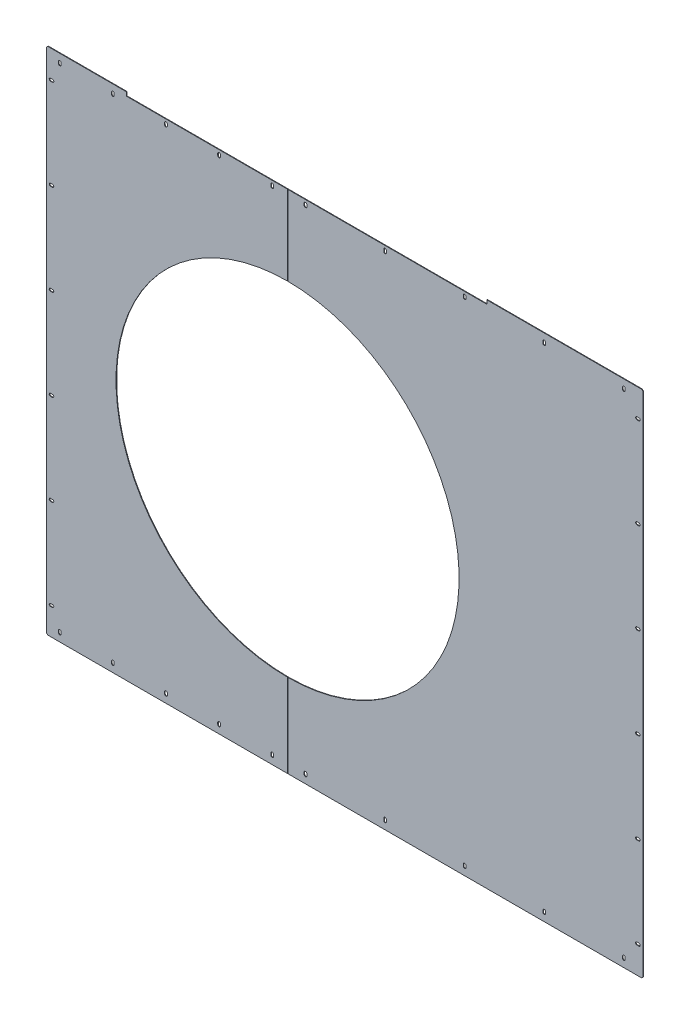
from build123d import *

# Parameters (mm, degrees)
SKETCH_1_W             = 1573
SKETCH_1_H             = 1345
SM_BASE_FLANGE_1_DEPTH = 1.5
SKETCH_4_R             = 452.5
CUT_EXTRUDE_1_DEPTH    = 10
SKETCH_5_W             = 1
SKETCH_5_H             = 1547.457087186
CUT_EXTRUDE_2_DEPTH    = 10
CHAMFER_1_SIZE         = 3
CHAMFER_2_SIZE         = 3
CUT_EXTRUDE_3_DEPTH    = 10
PATTERN_LINEAR_1_COUNT = 5
PATTERN_LINEAR_1_PITCH = 140
CUT_EXTRUDE_4_DEPTH    = 10
PATTERN_LINEAR_2_COUNT = 6
PATTERN_LINEAR_2_PITCH = 240
CUT_EXTRUDE_5_DEPTH    = 10
PATTERN_LINEAR_3_COUNT = 6
PATTERN_LINEAR_3_PITCH = 240
CUT_EXTRUDE_6_DEPTH    = 10
PATTERN_LINEAR_4_COUNT = 5
PATTERN_LINEAR_4_PITCH = 210
SKETCH_15_W            = 425
SKETCH_15_H            = 10
CUT_EXTRUDE_7_DEPTH    = 10
SKETCH_16_W            = 525
SKETCH_16_H            = 10
CUT_EXTRUDE_8_DEPTH    = 10


# Sheet-metal steps are written as plain solids
with BuildPart() as part:
    # Sketch 1 → 基体-法兰1 (new body)
    with BuildSketch(Plane.XY):
        Rectangle(SKETCH_1_W, SKETCH_1_H)
    extrude(amount=-SM_BASE_FLANGE_1_DEPTH)

    # Sketch 4 → 切除-拉伸1 (cut)
    with BuildSketch(Plane(origin=(0, 0, -1.5), x_dir=(-1, 0, 0), z_dir=(0, 0, -1))):
        with Locations((150.766280152, -6.702e-06)):
            Circle(SKETCH_4_R)
    extrude(amount=-CUT_EXTRUDE_1_DEPTH, mode=Mode.SUBTRACT)

    # 草图5 → 切除-拉伸2 (cut)
    with BuildSketch(Plane.XY):
        with Locations((-150.766280152, -6.702e-06)):
            Rectangle(SKETCH_5_W, SKETCH_5_H)
    extrude(amount=-CUT_EXTRUDE_2_DEPTH, mode=Mode.SUBTRACT)


with BuildPart() as cut_extrude_2_piece_1:
    # of the separate pieces the step leaves, piece 1, a body of its own (cut_extrude_2_pieces)
    add(part.part.solids().sort_by_distance((786.5, -672.5, 0))[0])

    # 倒角2
    chamfer_2_edges = [cut_extrude_2_piece_1.edges().sort_by_distance(p)[0] for p in [
        (786.5, 672.5, -0.75),
        (786.5, -672.5, -0.75),
    ]]
    chamfer(chamfer_2_edges, length=CHAMFER_2_SIZE)

    # 草图13 → 切除-拉伸5 (cut)
    with BuildSketch(Plane.XY):
        with BuildLine():
            Line((771, 603.5), (776, 603.5))
            ThreePointArc((776, 603.5), (779.5, 600), (776, 596.5))
            Line((776, 596.5), (771, 596.5))
            ThreePointArc((771, 596.5), (767.5, 600), (771, 603.5))
        make_face()
    cut_extrude_5 = extrude(amount=-CUT_EXTRUDE_5_DEPTH, mode=Mode.SUBTRACT)

    # 阵列(线性)3: 切除-拉伸5 ×6
    with Locations(*[(0, -i * PATTERN_LINEAR_3_PITCH, 0) for i in range(1, PATTERN_LINEAR_3_COUNT)]):
        add(cut_extrude_5, mode=Mode.SUBTRACT)

    # 草图14 → 切除-拉伸6 (cut)
    with BuildSketch(Plane.XY):
        with BuildLine():
            Line((740, 652.5), (740, 647.5))
            ThreePointArc((740, 647.5), (736.5, 644), (733, 647.5))
            Line((733, 647.5), (733, 652.5))
            ThreePointArc((733, 652.5), (736.5, 656), (740, 652.5))
        make_face()
        with BuildLine():
            Line((733, -652.5), (733, -647.5))
            ThreePointArc((733, -647.5), (736.5, -644), (740, -647.5))
            Line((740, -647.5), (740, -652.5))
            ThreePointArc((740, -652.5), (736.5, -656), (733, -652.5))
        make_face()
    cut_extrude_6 = extrude(amount=-CUT_EXTRUDE_6_DEPTH, mode=Mode.SUBTRACT)

    # 阵列(线性)4: 切除-拉伸6 ×5
    with Locations(*[(-i * PATTERN_LINEAR_4_PITCH, 0, 0) for i in range(1, PATTERN_LINEAR_4_COUNT)]):
        add(cut_extrude_6, mode=Mode.SUBTRACT)

    # 草图16 → 切除-拉伸8 (cut)
    with BuildSketch(Plane(origin=(0, 0, -1.5), x_dir=(-1, 0, 0), z_dir=(0, 0, -1))):
        with Locations((-112.233719848, 667.5)):
            Rectangle(SKETCH_16_W, SKETCH_16_H)
    extrude(amount=-CUT_EXTRUDE_8_DEPTH, mode=Mode.SUBTRACT)


with BuildPart() as cut_extrude_2_piece_2:
    # of the separate pieces the step leaves, piece 2, a body of its own (cut_extrude_2_pieces)
    add(part.part.solids().sort_by_distance((-151.266280152, -672.5, 0))[0])

    # 倒角1
    chamfer_1_edges = [cut_extrude_2_piece_2.edges().sort_by_distance(p)[0] for p in [
        (-786.5, 672.5, -0.75),
        (-786.5, -672.5, -0.75),
    ]]
    chamfer(chamfer_1_edges, length=CHAMFER_1_SIZE)

    # 草图10 → 切除-拉伸3 (cut)
    with BuildSketch(Plane.XY):
        with BuildLine():
            Line((-755, 647.5), (-755, 652.5))
            ThreePointArc((-755, 652.5), (-751.5, 656), (-748, 652.5))
            Line((-748, 652.5), (-748, 647.5))
            ThreePointArc((-748, 647.5), (-751.5, 644), (-755, 647.5))
        make_face()
        with BuildLine():
            Line((-755, -652.5), (-755, -647.5))
            ThreePointArc((-755, -647.5), (-751.5, -644), (-748, -647.5))
            Line((-748, -647.5), (-748, -652.5))
            ThreePointArc((-748, -652.5), (-751.5, -656), (-755, -652.5))
        make_face()
    cut_extrude_3 = extrude(amount=-CUT_EXTRUDE_3_DEPTH, mode=Mode.SUBTRACT)

    # 阵列(线性)1: 切除-拉伸3 ×5
    with Locations(*[(i * PATTERN_LINEAR_1_PITCH, 0, 0) for i in range(1, PATTERN_LINEAR_1_COUNT)]):
        add(cut_extrude_3, mode=Mode.SUBTRACT)

    # 草图12 → 切除-拉伸4 (cut)
    with BuildSketch(Plane.XY):
        with BuildLine():
            Line((-776, 603.5), (-771, 603.5))
            ThreePointArc((-771, 603.5), (-767.5, 600), (-771, 596.5))
            Line((-771, 596.5), (-776, 596.5))
            ThreePointArc((-776, 596.5), (-779.5, 600), (-776, 603.5))
        make_face()
    cut_extrude_4 = extrude(amount=-CUT_EXTRUDE_4_DEPTH, mode=Mode.SUBTRACT)

    # 阵列(线性)2: 切除-拉伸4 ×6
    with Locations(*[(0, -i * PATTERN_LINEAR_2_PITCH, 0) for i in range(1, PATTERN_LINEAR_2_COUNT)]):
        add(cut_extrude_4, mode=Mode.SUBTRACT)

    # 草图15 → 切除-拉伸7 (cut)
    with BuildSketch(Plane(origin=(0, 0, -1.5), x_dir=(-1, 0, 0), z_dir=(0, 0, -1))):
        with Locations((363.766280152, 667.5)):
            Rectangle(SKETCH_15_W, SKETCH_15_H)
    extrude(amount=-CUT_EXTRUDE_7_DEPTH, mode=Mode.SUBTRACT)


solid = Compound([cut_extrude_2_piece_1.part, cut_extrude_2_piece_2.part])
